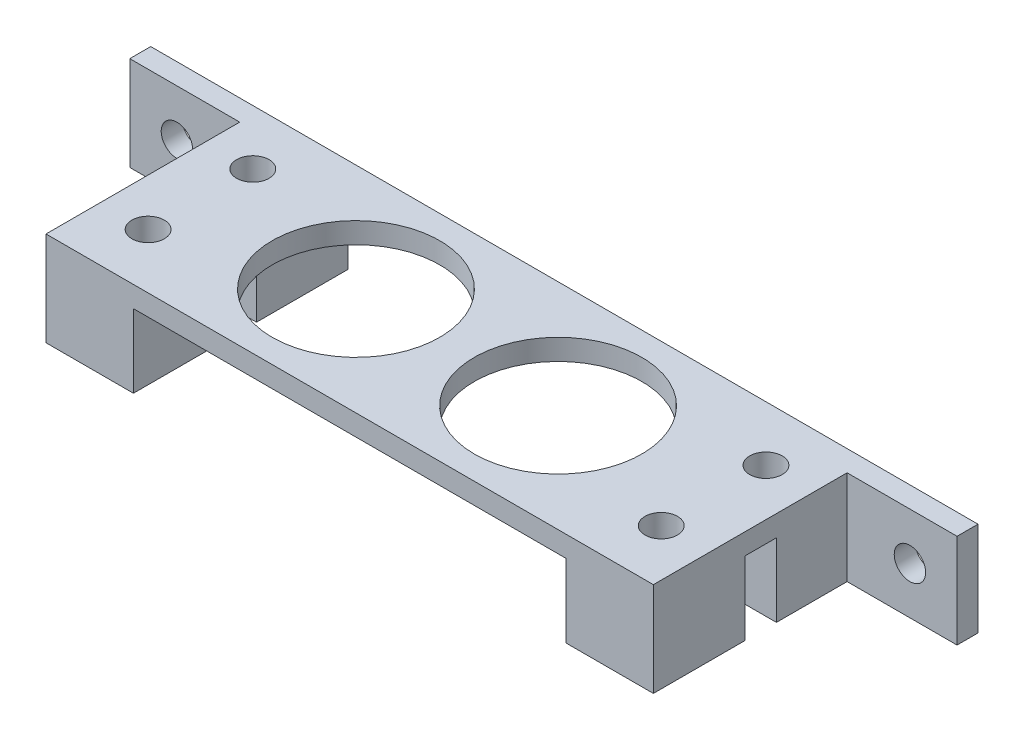
from build123d import *

# Parameters (mm, degrees)
SKETCH2_W           = 58
SKETCH2_H           = 20.5
SKETCH2_R           = 1.55
SKETCH2_R_2         = 8
BOSS_EXTRUDE1_DEPTH = 2
BOSS_EXTRUDE2_START = 7
SKETCH3_W           = 8.35
SKETCH3_H           = 8.75
SKETCH3_R           = 1.55
BOSS_EXTRUDE2_DEPTH = 7
SKETCH4_W           = 10.5
SKETCH4_H           = 9
SKETCH4_R           = 1.5
BOSS_EXTRUDE3_DEPTH = 2


with BuildPart() as part:
    # Sketch2 → Boss-Extrude1 (new body)
    with BuildSketch(Plane(origin=(0, 0, 0), x_dir=(1, 0, 0), z_dir=(0, 1, 0))):
        Rectangle(SKETCH2_W, SKETCH2_H)
        with Locations((-24.5, -5)):
            Circle(SKETCH2_R, mode=Mode.SUBTRACT)
        with Locations((24.5, -5)):
            Circle(SKETCH2_R, mode=Mode.SUBTRACT)
        with Locations((-24.5, 5)):
            Circle(SKETCH2_R, mode=Mode.SUBTRACT)
        with Locations((-9.65, 0)):
            Circle(SKETCH2_R_2, mode=Mode.SUBTRACT)
        with Locations((9.65, 0)):
            Circle(SKETCH2_R_2, mode=Mode.SUBTRACT)
        with Locations((24.5, 5)):
            Circle(SKETCH2_R, mode=Mode.SUBTRACT)
    extrude(amount=BOSS_EXTRUDE1_DEPTH)

    # Sketch3 → Boss-Extrude2 (add)
    # profile 1 of 4: a face of its own
    with BuildSketch(Plane.XZ.offset(BOSS_EXTRUDE2_START)):
        with Locations((-24.825, 5.875)):
            Rectangle(SKETCH3_W, SKETCH3_H)
        with Locations((-24.5, 5)):
            Circle(SKETCH3_R, mode=Mode.SUBTRACT)
    # profile 2 of 4: a face of its own
    with BuildSketch(Plane.XZ.offset(BOSS_EXTRUDE2_START)):
        with Locations((24.825, 5.875)):
            Rectangle(SKETCH3_W, SKETCH3_H)
        with Locations((24.5, 5)):
            Circle(SKETCH3_R, mode=Mode.SUBTRACT)
    # profile 3 of 4: a face of its own
    with BuildSketch(Plane.XZ.offset(BOSS_EXTRUDE2_START)):
        with Locations((-24.825, -5.875)):
            Rectangle(SKETCH3_W, SKETCH3_H)
        with Locations((-24.5, -5)):
            Circle(SKETCH3_R, mode=Mode.SUBTRACT)
    # profile 4 of 4: a face of its own
    with BuildSketch(Plane.XZ.offset(BOSS_EXTRUDE2_START)):
        with Locations((24.825, -5.875)):
            Rectangle(SKETCH3_W, SKETCH3_H)
        with Locations((24.5, -5)):
            Circle(SKETCH3_R, mode=Mode.SUBTRACT)
    extrude(amount=-BOSS_EXTRUDE2_DEPTH)

    # Sketch4 → Boss-Extrude3 (add)
    # profile 1 of 2: a face of its own
    with BuildSketch(Plane(origin=(0, 0, -10.25), x_dir=(-1, 0, 0), z_dir=(0, 0, -1))):
        with Locations((34.25, -2.5)):
            Rectangle(SKETCH4_W, SKETCH4_H)
        with Locations((35, -2.5)):
            Circle(SKETCH4_R, mode=Mode.SUBTRACT)
    # profile 2 of 2: a face of its own
    with BuildSketch(Plane(origin=(0, 0, -10.25), x_dir=(-1, 0, 0), z_dir=(0, 0, -1))):
        with Locations((-34.25, -2.5)):
            Rectangle(SKETCH4_W, SKETCH4_H)
        with Locations((-35, -2.5)):
            Circle(SKETCH4_R, mode=Mode.SUBTRACT)
    extrude(amount=-BOSS_EXTRUDE3_DEPTH)


solid = part.part
